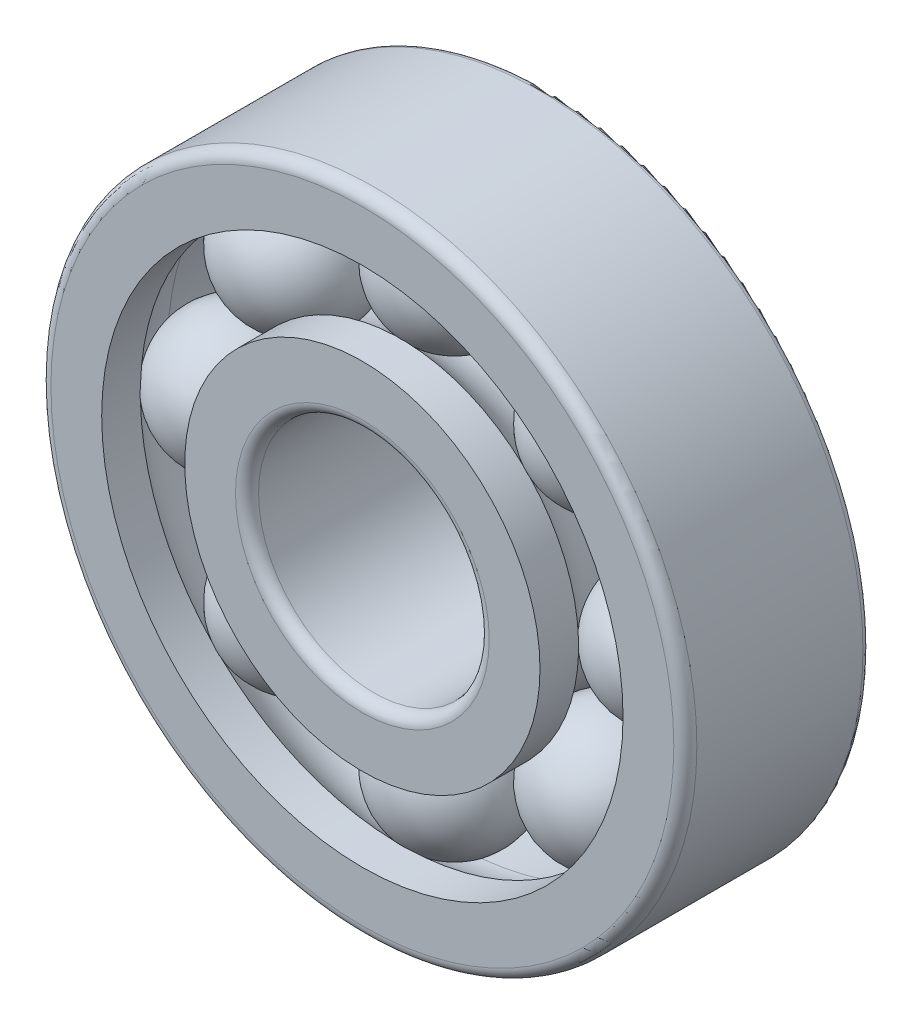
from build123d import *

# Parameters (mm, degrees)
FILLET1_R            = 0.5
FILLET2_R            = 0.3
CIRPATTERNBALL_COUNT = 8


with BuildPart() as part:
    # BaseSke → Ball (revolve)
    with BuildSketch(Plane(origin=(0, 0, 0), x_dir=(0, 0, -1), z_dir=(1, 0, 0))):
        with BuildLine():
            Line((0, 12.45), (0, 6.55))
            ThreePointArc((0, 6.55), (-2.95, 9.5), (0, 12.45))
        make_face()
    ball = revolve(axis=Axis((0, 12.45, 0), (0, -1, 0)))

    # OuterRaceSke → OuterRace (revolve)
    with BuildSketch(Plane(origin=(0, 0, 0), x_dir=(0, 0, -1), z_dir=(1, 0, 0))):
        with BuildLine():
            Line((-4, 14), (4, 14))
            Line((4, 14), (4, 12.44))
            Line((4, 12.44), (0, 12.44))
            ThreePointArc((0, 12.44), (-1.294526941, 12.139659069), (-2.324564475, 11.3))
            Line((-2.324564475, 11.3), (-4, 11.3))
            Line((-4, 11.3), (-4, 14))
        make_face()
    revolve(axis=Axis((0, 0, 50.391616343), (0, 0, -1)))

    # InnerRaceSke → InnerRace (revolve)
    with BuildSketch(Plane(origin=(0, 0, 0), x_dir=(0, 0, -1), z_dir=(1, 0, 0))):
        with BuildLine():
            Line((-4, 5), (4, 5))
            Line((4, 5), (4, 7.7))
            Line((4, 7.7), (2.324564475, 7.7))
            ThreePointArc((2.324564475, 7.7), (0, 6.56), (-2.324564475, 7.7))
            Line((-2.324564475, 7.7), (-4, 7.7))
            Line((-4, 7.7), (-4, 5))
        make_face()
    revolve(axis=Axis((0, 0, 70.862590906), (0, 0, -1)))

    # Fillet1
    fillet1_edges = [part.edges().sort_by_distance(p)[0] for p in [
        (0, -5, -4),
        (0, -5, 4),
        (0, -14, 4),
    ]]
    fillet(fillet1_edges, radius=FILLET1_R)

    # Fillet2
    fillet2_edges = [part.edges().sort_by_distance(p)[0] for p in [
        (0, -14, -4),
    ]]
    fillet(fillet2_edges, radius=FILLET2_R)

    # CirPatternBall: Ball ×8 about axis
    cirpatternball_axis = Axis((0, 0, 50.391616343), (0, 0, -1))
    for i in range(1, CIRPATTERNBALL_COUNT):
        add(ball.rotate(cirpatternball_axis, i * 360 / CIRPATTERNBALL_COUNT))


solid = part.part
